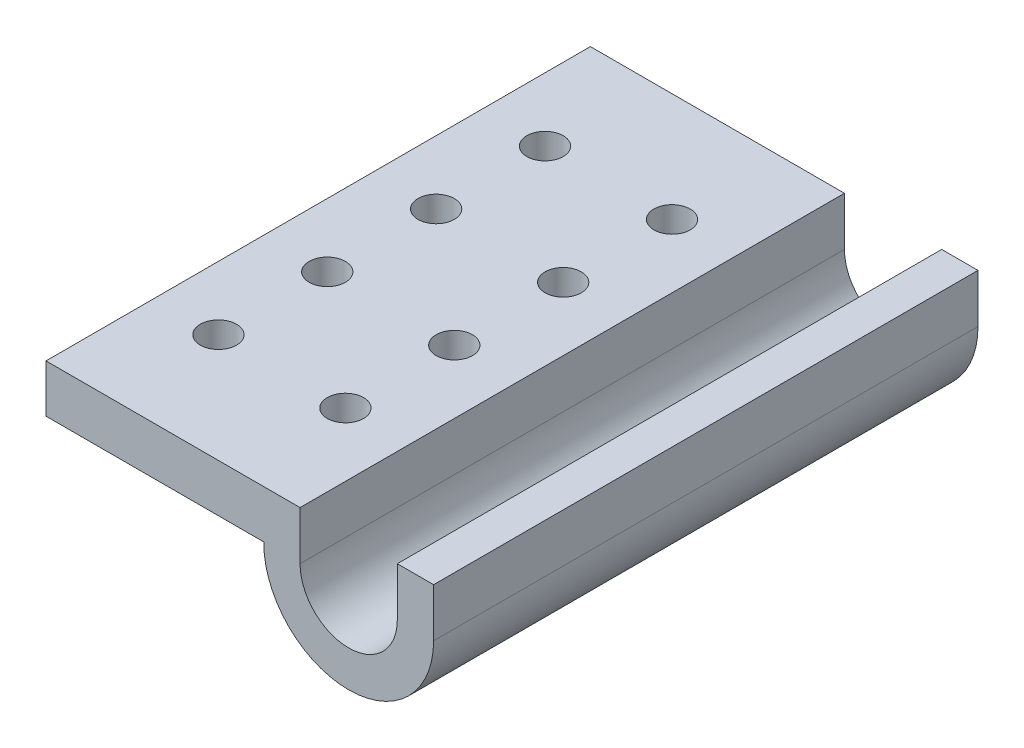
from build123d import *

# Parameters (mm, degrees)
SKETCH3_W           = 5
SKETCH3_H           = 6.7
BOSS_EXTRUDE2_DEPTH = 75
SWEEP1_DEPTH        = 75
SKETCH8_W           = 5
SKETCH8_H           = 75
BOSS_EXTRUDE3_DEPTH = 6.7
SKETCH11_W          = 75
SKETCH11_H          = 6.6
BOSS_EXTRUDE4_DEPTH = 30
SKETCH12_R          = 2.5
CUT_EXTRUDE1_DEPTH  = 60


# Read off the part's stored shape, not the designer's step: Sweep1
with BuildPart() as part:
    # Sketch3 → Boss-Extrude2 (new body)
    with BuildSketch(Plane.XY):
        with Locations((-9.2, 3.35)):
            Rectangle(SKETCH3_W, SKETCH3_H)
    extrude(amount=BOSS_EXTRUDE2_DEPTH)

    # Sweep1 outline → Sweep1 (add)
    with BuildSketch(Plane.XY):
        with BuildLine():
            ThreePointArc((-11.7, 0), (0, -11.7), (11.7, 0))
            Line((11.7, 0), (6.7, 0))
            ThreePointArc((6.7, 0), (0, -6.7), (-6.7, 0))
            Line((-6.7, 0), (-11.7, 0))
        make_face()
    extrude(amount=SWEEP1_DEPTH)

    # Sketch8 → Boss-Extrude3 (add)
    with BuildSketch(Plane(origin=(0, 0, 0), x_dir=(1, 0, 0), z_dir=(0, 1, 0))):
        with Locations((9.2, -37.5)):
            Rectangle(SKETCH8_W, SKETCH8_H)
    extrude(amount=BOSS_EXTRUDE3_DEPTH)

    # Sketch11 → Boss-Extrude4 (add)
    with BuildSketch(Plane.ZY.offset(11.7)):
        with Locations((37.5, 3.4)):
            Rectangle(SKETCH11_W, SKETCH11_H)
    extrude(amount=BOSS_EXTRUDE4_DEPTH)

    # Sketch12 → Cut-Extrude1 (cut)
    with BuildSketch(Plane(origin=(0, 6.7, 0), x_dir=(1, 0, 0), z_dir=(0, 1, 0))):
        with Locations(Location((-15.45, -60, 0), (0, 0, 180))):
            Circle(SKETCH12_R)
        with Locations(Location((-15.45, -45, 0), (0, 0, 180))):
            Circle(SKETCH12_R)
        with Locations(Location((-32.95, -45, 0), (0, 0, 180))):
            Circle(SKETCH12_R)
        with Locations(Location((-32.95, -60, 0), (0, 0, 180))):
            Circle(SKETCH12_R)
        with Locations(Location((-15.45, -30, 0), (0, 0, 180))):
            Circle(SKETCH12_R)
        with Locations(Location((-32.95, -30, 0), (0, 0, 180))):
            Circle(SKETCH12_R)
        with Locations(Location((-15.45, -15, 0), (0, 0, 180))):
            Circle(SKETCH12_R)
        with Locations(Location((-32.95, -15, 0), (0, 0, 180))):
            Circle(SKETCH12_R)
    extrude(amount=-CUT_EXTRUDE1_DEPTH, mode=Mode.SUBTRACT)


solid = part.part
